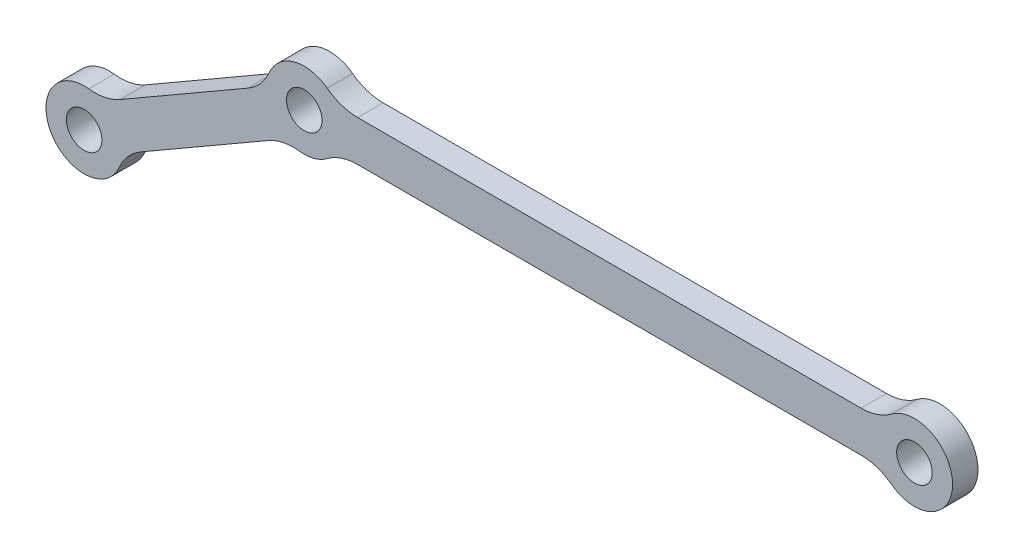
from build123d import *

# Parameters (mm, degrees)
SKETCH1_R          = 3.5
BASE_FLANGE1_DEPTH = 5
FILLET1_R          = 10


# Sheet-metal steps are written as plain solids
with BuildPart() as part:
    # Sketch1 → Base-Flange1 (new body)
    with BuildSketch(Plane.XY):
        with BuildLine():
            Line((-155.806954945, -25.29195723), (-123.494315244, -6.636246))
            ThreePointArc((-123.494315244, -6.636246), (-118.058857162, -7.244443697), (-113.65571123, -4))
            Line((-113.65571123, -4), (-6.34428877, -4))
            ThreePointArc((-6.34428877, -4), (7.5, 0), (-6.34428877, 4))
            Line((-6.34428877, 4), (-113.65571123, 4))
            ThreePointArc((-113.65571123, 4), (-121.941142838, 7.244443697), (-127.494315244, 0.29195723))
            Line((-127.494315244, 0.29195723), (-159.806954945, -18.363754))
            ThreePointArc((-159.806954945, -18.363754), (-169.796460718, -28.75), (-155.806954945, -25.29195723))
        make_face()
        Circle(SKETCH1_R, mode=Mode.SUBTRACT)
        with Locations((-120, 0)):
            Circle(SKETCH1_R, mode=Mode.SUBTRACT)
        with Locations((-163.301270189, -25)):
            Circle(SKETCH1_R, mode=Mode.SUBTRACT)
    extrude(amount=-BASE_FLANGE1_DEPTH)

    # Fillet1
    fillet1_edges = [part.edges().sort_by_distance(p)[0] for p in [
        (-159.806954945, -18.363754, -2.5),
        (-127.494315244, 0.29195723, -2.5),
        (-113.65571123, 4, -2.5),
        (-6.34428877, 4, -2.5),
        (-6.34428877, -4, -2.5),
        (-113.65571123, -4, -2.5),
        (-123.494315244, -6.636246, -2.5),
        (-155.806954945, -25.29195723, -2.5),
    ]]
    fillet(fillet1_edges, radius=FILLET1_R)


solid = part.part
